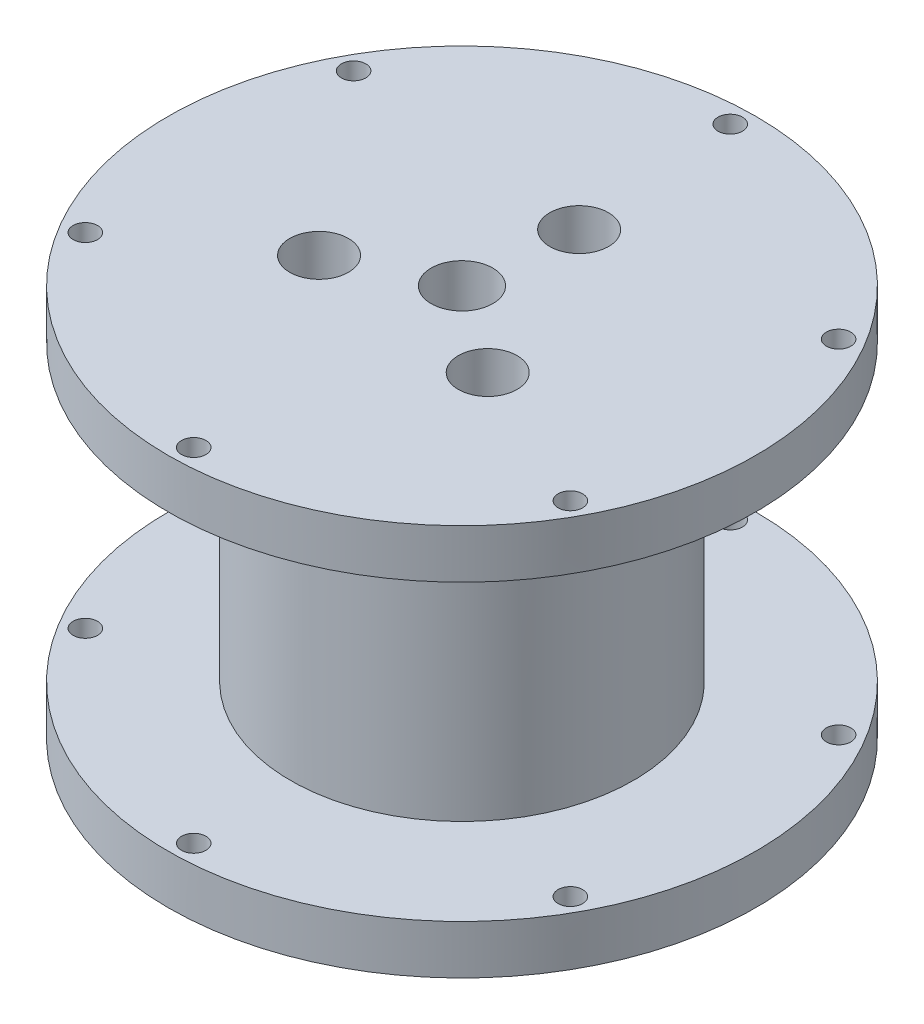
from build123d import *

# Parameters (mm, degrees)
SKETCH1_R               = 30
BOSS_EXTRUDE1_DEPTH     = 40
CUT_EXTRUDE1_START      = -5
SKETCH2_OUTSIDE_W       = 80.762
SKETCH2_OUTSIDE_H       = 80.762
SKETCH2_OUTSIDE_R       = 17.5
CUT_EXTRUDE1_DEPTH      = 30
SKETCH3_R               = 3.15
CUT_EXTRUDE2_DEPTH      = 59.309518948
CUT_EXTRUDE3_DEPTH      = 59.309518948
CUT_EXTRUDE4_REACH      = 60
CUT_EXTRUDE4_START      = 3
SKETCH5_R               = 2
CUT_EXTRUDE5_DEPTH      = 7.5
FILLET1_R               = 2
CUT_EXTRUDE6_DEPTH      = 59.309518948
CUT_EXTRUDE6_DEPTH_BACK = 59.309518948


with BuildPart() as part:
    # Sketch1 → Boss-Extrude1 (new body)
    with BuildSketch(Plane(origin=(0, 0, 0), x_dir=(1, 0, 0), z_dir=(0, 1, 0))):
        with Locations(Location((0, 0, 0), (0, 0, 270))):
            Circle(SKETCH1_R)
    extrude(amount=BOSS_EXTRUDE1_DEPTH)

    # Sketch2 outside → Cut-Extrude1 (cut)
    with BuildSketch(Plane.XZ.offset(CUT_EXTRUDE1_START)):
        Rectangle(SKETCH2_OUTSIDE_W, SKETCH2_OUTSIDE_H)
        with Locations(Location((0, 0, 0), (0, 0, 270))):
            Circle(SKETCH2_OUTSIDE_R, mode=Mode.SUBTRACT)
    extrude(amount=-CUT_EXTRUDE1_DEPTH, mode=Mode.SUBTRACT)

    # Sketch3 → Cut-Extrude2 (cut, through all)
    with BuildSketch(Plane.XZ):
        with Locations(Location((0, 0, 0), (0, 0, 270))):
            Circle(SKETCH3_R)
    extrude(amount=-CUT_EXTRUDE2_DEPTH, mode=Mode.SUBTRACT)

    # Sketch4 → Cut-Extrude3 (cut, through all)
    with BuildSketch(Plane.XZ):
        with BuildLine():
            ThreePointArc((3.997571838, -10.67798761), (0.734727839, -7.966189491), (-1.97707028, -11.229033489))
            Line((-1.97707028, -11.229033489), (3.997571838, -10.67798761))
        make_face()
        with BuildLine():
            Line((3.997571838, -10.67798761), (-1.97707028, -11.229033489))
            ThreePointArc((-1.97707028, -11.229033489), (1.148158035, -13.950339138), (4.010250779, -10.95351055))
            ThreePointArc((4.010250779, -10.95351055), (4.007079367, -10.815603293), (3.997571838, -10.67798761))
        make_face()
        with BuildLine():
            ThreePointArc((7.248622613, 8.80099257), (6.531558551, 4.619387719), (10.713163402, 3.902323657))
            Line((10.713163402, 3.902323657), (7.248622613, 8.80099257))
        make_face()
        with BuildLine():
            Line((7.248622613, 8.80099257), (10.713163402, 3.902323657))
            ThreePointArc((10.713163402, 3.902323657), (11.645176324, 4.972675007), (11.980893007, 6.351658113))
            ThreePointArc((11.980893007, 6.351658113), (10.359876114, 9.01594143), (7.248622613, 8.80099257))
        make_face()
        with BuildLine():
            ThreePointArc((-8.736093122, 7.326709833), (-12.716001182, 5.856903101), (-11.246194451, 1.87699504))
            Line((-11.246194451, 1.87699504), (-8.736093122, 7.326709833))
        make_face()
        with BuildLine():
            Line((-8.736093122, 7.326709833), (-11.246194451, 1.87699504))
            ThreePointArc((-11.246194451, 1.87699504), (-8.373298304, 2.075476376), (-6.991143786, 4.601852436))
            ThreePointArc((-6.991143786, 4.601852436), (-7.464767726, 6.219697918), (-8.736093122, 7.326709833))
        make_face()
    extrude(amount=-CUT_EXTRUDE3_DEPTH, mode=Mode.SUBTRACT)

    # Sketch5 → Cut-Extrude4 (cut, up to next)
    with BuildSketch(Plane(origin=(0, 5, 0), x_dir=(1, 0, 0), z_dir=(0, 1, 0)).offset(CUT_EXTRUDE4_START), mode=Mode.PRIVATE) as cut_extrude4_sk1:
        with Locations(Location((-15.339737127, 8.422734999, 0), (0, 0, 270))):
            Circle(SKETCH5_R)
    cut_extrude4_tool1 = extrude(cut_extrude4_sk1.sketch, amount=-CUT_EXTRUDE4_REACH, mode=Mode.PRIVATE) & part.part
    add(cut_extrude4_tool1.solids().sort_by_distance((-15.339737, 8, -8.422735))[0], mode=Mode.SUBTRACT)

    # Sketch6 → Cut-Extrude5 (cut)
    with BuildSketch(Plane.XZ):
        Polygon((-6.311193726, -0.70863749), (-2.541898795, -5.819972839), (3.769294931, -5.11133535), (6.311193726, 0.70863749), (2.541898795, 5.819972839), (-3.769294931, 5.11133535), align=None)
    extrude(amount=-CUT_EXTRUDE5_DEPTH, mode=Mode.SUBTRACT)

    # Fillet1
    fillet1_edges = [part.edges().sort_by_distance(p)[0] for p in [
        (-13.417435738, 8, -7.870686661),
    ]]
    fillet(fillet1_edges, radius=FILLET1_R - 0.0001)  # a hair under: the kernel refuses the full size

    # Sketch7 → Cut-Extrude6 (cut, two sides: drawn at the far end of the back side and taken through both)
    with BuildSketch(Plane(origin=(0, 0, 0), x_dir=(-1, 0, 0), z_dir=(0, -1, 0)).offset(-CUT_EXTRUDE6_DEPTH_BACK)):
        with BuildLine():
            Line((-24.516753255, -12.226663888), (-24.543579404, -13.476375998))
            Line((-24.543579404, -13.476375998), (-23.474710044, -14.12446418))
            ThreePointArc((-23.474710044, -14.12446418), (-23.339713402, -13.812837958), (-23.293579404, -13.476375998))
            ThreePointArc((-23.293579404, -13.476375998), (-23.650261799, -12.602028438), (-24.516753255, -12.226663888))
        make_face()
        with BuildLine():
            Line((-23.474710044, -14.12446418), (-24.543579404, -13.476375998))
            Line((-24.543579404, -13.476375998), (-24.516753255, -12.226663888))
            ThreePointArc((-24.516753255, -12.226663888), (-25.639274913, -14.077999927), (-23.474710044, -14.12446418))
        make_face()
        with BuildLine():
            ThreePointArc((0.494789773, -27.391927334), (-0.574079587, -26.743839153), (-1.669775096, -27.345463081))
            Line((-1.669775096, -27.345463081), (-0.600905736, -27.993551263))
            Line((-0.600905736, -27.993551263), (0.494789773, -27.391927334))
        make_face()
        with BuildLine():
            Line((-0.600905736, -27.993551263), (-1.669775096, -27.345463081))
            ThreePointArc((-1.669775096, -27.345463081), (-0.937367695, -29.197417264), (0.649094264, -27.993551263))
            ThreePointArc((0.649094264, -27.993551263), (0.609903783, -27.683002866), (0.494789773, -27.391927334))
            Line((0.494789773, -27.391927334), (-0.600905736, -27.993551263))
        make_face()
        with BuildLine():
            ThreePointArc((23.969499816, -13.267463154), (22.873804307, -13.869087083), (22.846978158, -15.118799193))
            Line((22.846978158, -15.118799193), (23.942673667, -14.517175264))
            Line((23.942673667, -14.517175264), (23.969499816, -13.267463154))
        make_face()
        with BuildLine():
            Line((23.942673667, -14.517175264), (22.846978158, -15.118799193))
            ThreePointArc((22.846978158, -15.118799193), (24.253222064, -15.727984784), (25.192673667, -14.517175264))
            ThreePointArc((25.192673667, -14.517175264), (24.835991272, -13.642827704), (23.969499816, -13.267463154))
            Line((23.969499816, -13.267463154), (23.942673667, -14.517175264))
        make_face()
        with BuildLine():
            ThreePointArc((23.474710044, 14.12446418), (23.447883895, 12.87475207), (24.516753255, 12.226663888))
            Line((24.516753255, 12.226663888), (24.543579404, 13.476375998))
            Line((24.543579404, 13.476375998), (23.474710044, 14.12446418))
        make_face()
        with BuildLine():
            Line((24.543579404, 13.476375998), (24.516753255, 12.226663888))
            ThreePointArc((24.516753255, 12.226663888), (25.417926964, 12.583058394), (25.793579404, 13.476375998))
            ThreePointArc((25.793579404, 13.476375998), (24.880041363, 14.680242), (23.474710044, 14.12446418))
            Line((23.474710044, 14.12446418), (24.543579404, 13.476375998))
        make_face()
        with BuildLine():
            ThreePointArc((1.850905736, 27.993551263), (0.290357339, 29.204360782), (-0.494789773, 27.391927334))
            Line((-0.494789773, 27.391927334), (0.600905736, 27.993551263))
            Line((0.600905736, 27.993551263), (1.669775096, 27.345463081))
            ThreePointArc((1.669775096, 27.345463081), (1.804771738, 27.657089304), (1.850905736, 27.993551263))
        make_face()
        with BuildLine():
            Line((0.600905736, 27.993551263), (-0.494789773, 27.391927334))
            ThreePointArc((-0.494789773, 27.391927334), (0.574079587, 26.743839153), (1.669775096, 27.345463081))
            Line((1.669775096, 27.345463081), (0.600905736, 27.993551263))
        make_face()
        with BuildLine():
            ThreePointArc((-22.846978158, 15.118799193), (-25.011543028, 15.165263446), (-23.969499816, 13.267463154))
            Line((-23.969499816, 13.267463154), (-23.942673667, 14.517175264))
            Line((-23.942673667, 14.517175264), (-22.846978158, 15.118799193))
        make_face()
        with BuildLine():
            Line((-23.942673667, 14.517175264), (-23.969499816, 13.267463154))
            ThreePointArc((-23.969499816, 13.267463154), (-23.068326107, 13.623857659), (-22.692673667, 14.517175264))
            ThreePointArc((-22.692673667, 14.517175264), (-22.731864148, 14.827723661), (-22.846978158, 15.118799193))
            Line((-22.846978158, 15.118799193), (-23.942673667, 14.517175264))
        make_face()
    extrude(amount=CUT_EXTRUDE6_DEPTH + CUT_EXTRUDE6_DEPTH_BACK, mode=Mode.SUBTRACT)


solid = part.part
